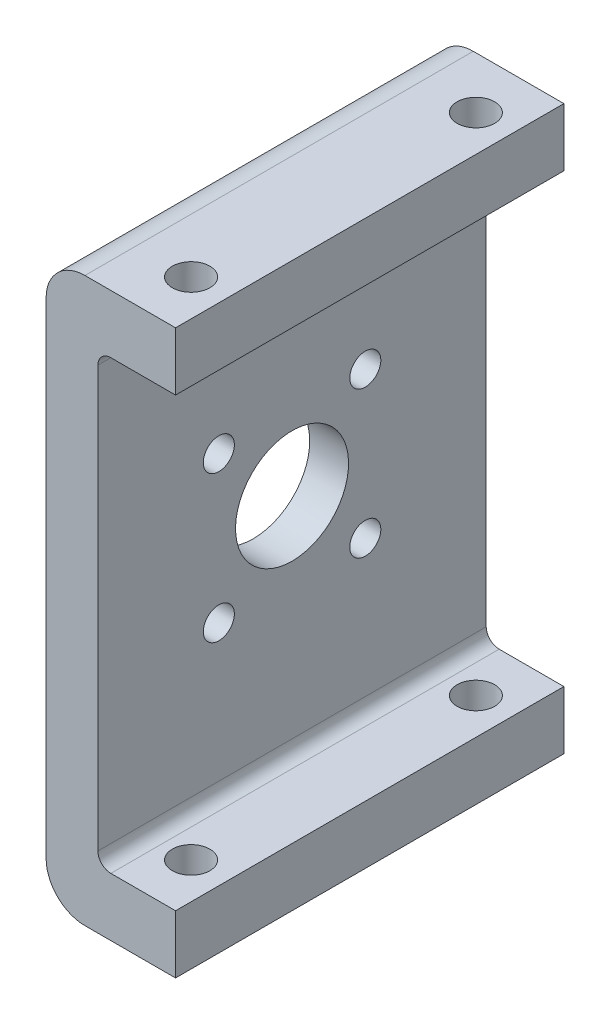
from build123d import *

# Parameters (mm, degrees)
BOSS_EXTRUDE1_DEPTH     = 15
M2_5_CLEARANCE_HOLE1_D  = 2.9
CUT_EXTRUDE1_DEPTH      = 28.093587802
CUT_EXTRUDE1_DEPTH_BACK = 28.093587802
SKETCH3_R               = 4.365625
M2_CLEARANCE_HOLE1_D    = 2.4
SKETCH10_R              = 11.5
CUT_EXTRUDE3_DEPTH      = 1
FILLET1_R               = 1
FILLET2_R               = 3


with BuildPart() as part:
    # Sketch2 → Boss-Extrude1 (new, symmetric)
    with BuildSketch(Plane.XY):
        Polygon((0, 21.75), (0, -21.75), (10, -21.75), (10, -17.25), (4, -17.25), (4, 17.25), (10, 17.25), (10, 21.75), align=None)
    extrude(amount=BOSS_EXTRUDE1_DEPTH, both=True)

    # M2.5 Clearance Hole1 (through all)
    with Locations(Plane(origin=(0, -21.75, 0), x_dir=(-1, 0, 0), z_dir=(0, -1, 0))):
        with Locations((-7.2, -11), (-7.2, 11)):
            Hole(M2_5_CLEARANCE_HOLE1_D / 2)

    # Sketch3 → Cut-Extrude1 (cut, two sides: drawn at the far end of the back side and taken through both)
    with BuildSketch(Plane(origin=(4, 0, 0), x_dir=(0, 0, -1), z_dir=(1, 0, 0)).offset(-CUT_EXTRUDE1_DEPTH_BACK)):
        Circle(SKETCH3_R)
    extrude(amount=CUT_EXTRUDE1_DEPTH + CUT_EXTRUDE1_DEPTH_BACK, mode=Mode.SUBTRACT)

    # M2 Clearance Hole1 (through all)
    with Locations(Plane.ZY):
        with Locations((5.656854249, 5.656854249), (5.656854249, -5.656854249), (-5.656854249, -5.656854249), (-5.656854249, 5.656854249), (0, 0)):
            Hole(M2_CLEARANCE_HOLE1_D / 2)

    # Sketch10 → Cut-Extrude3 (cut)
    with BuildSketch(Plane.ZY):
        Circle(SKETCH10_R)
    extrude(amount=-CUT_EXTRUDE3_DEPTH, mode=Mode.SUBTRACT)

    # Fillet1
    fillet1_edges = [part.edges().sort_by_distance(p)[0] for p in [
        (4, -17.25, 0),
        (4, 17.25, 0),
    ]]
    fillet(fillet1_edges, radius=FILLET1_R)

    # Fillet2
    fillet2_edges = [part.edges().sort_by_distance(p)[0] for p in [
        (0, -21.75, 0),
        (0, 21.75, 0),
    ]]
    fillet(fillet2_edges, radius=FILLET2_R)


solid = part.part
